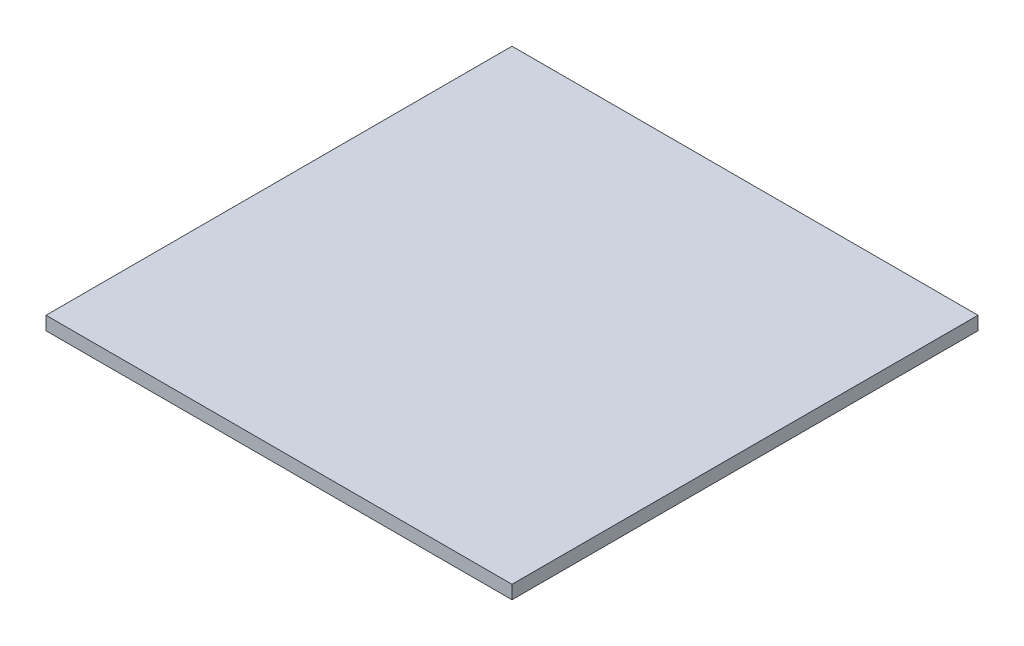
from build123d import *

# Parameters (mm, degrees)
SKETCH1_W           = 1040
SKETCH1_H           = 1040
BOSS_EXTRUDE1_DEPTH = 30


with BuildPart() as part:
    # Sketch1 → Boss-Extrude1 (new body)
    with BuildSketch(Plane(origin=(0, 0, 0), x_dir=(1, 0, 0), z_dir=(0, 1, 0))):
        Rectangle(SKETCH1_W, SKETCH1_H)
    extrude(amount=BOSS_EXTRUDE1_DEPTH)


solid = part.part
